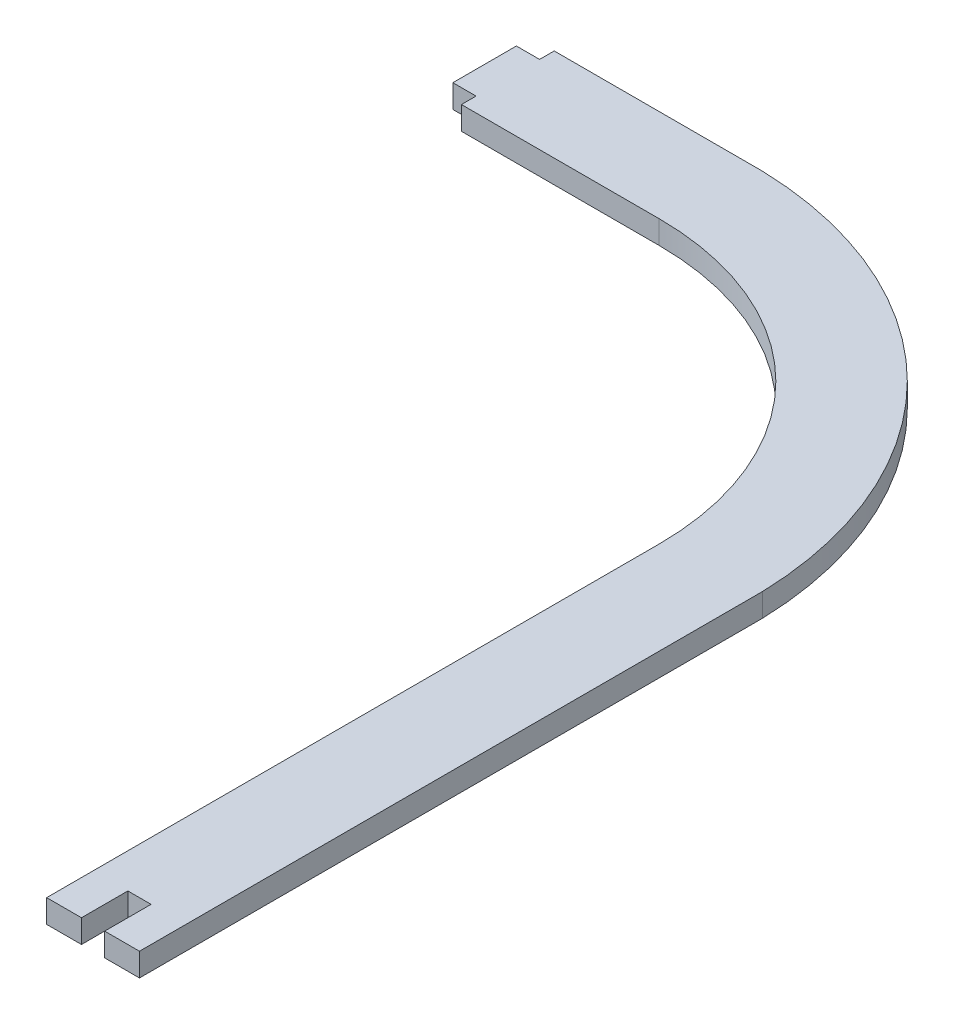
from build123d import *

# Parameters (mm, degrees)
SALIENTE_EXTRUIR1_DEPTH = 3


with BuildPart() as part:
    # Croquis1 → Saliente-Extruir1 (new body)
    with BuildSketch(Plane(origin=(0, 0, 0), x_dir=(1, 0, 0), z_dir=(0, 1, 0))):
        with BuildLine():
            Line((0, 7.786096257), (0, 0))
            Line((0, 0), (0, -0.213903743))
            Line((0, -0.213903743), (3, -0.213903743))
            Line((3, -0.213903743), (3, -2.106951872))
            Line((3, -2.106951872), (7.35828877, -2.106951872))
            Line((7.35828877, -2.106951872), (28.573593129, -2.106951872))
            ThreePointArc((28.573593129, -2.106951872), (54.330952442, -12.77599943), (65, -38.533358743))
            Line((65, -38.533358743), (65, -117.736951872))
            Line((65, -117.736951872), (69.5, -117.736951872))
            Line((69.5, -117.736951872), (69.5, -111.736951872))
            Line((69.5, -111.736951872), (72.5, -111.736951872))
            Line((72.5, -111.736951872), (72.5, -117.736951872))
            Line((72.5, -117.736951872), (77, -117.736951872))
            Line((77, -117.736951872), (77, -37.153707926))
            ThreePointArc((77, -37.153707926), (62.830127679, -4.276824192), (29.953243946, 9.893048128))
            Line((29.953243946, 9.893048128), (7.35828877, 9.893048128))
            Line((7.35828877, 9.893048128), (3, 9.893048128))
            Line((3, 9.893048128), (3, 8))
            Line((3, 8), (0, 8))
            Line((0, 8), (0, 7.786096257))
        make_face()
    extrude(amount=SALIENTE_EXTRUIR1_DEPTH)


solid = part.part
